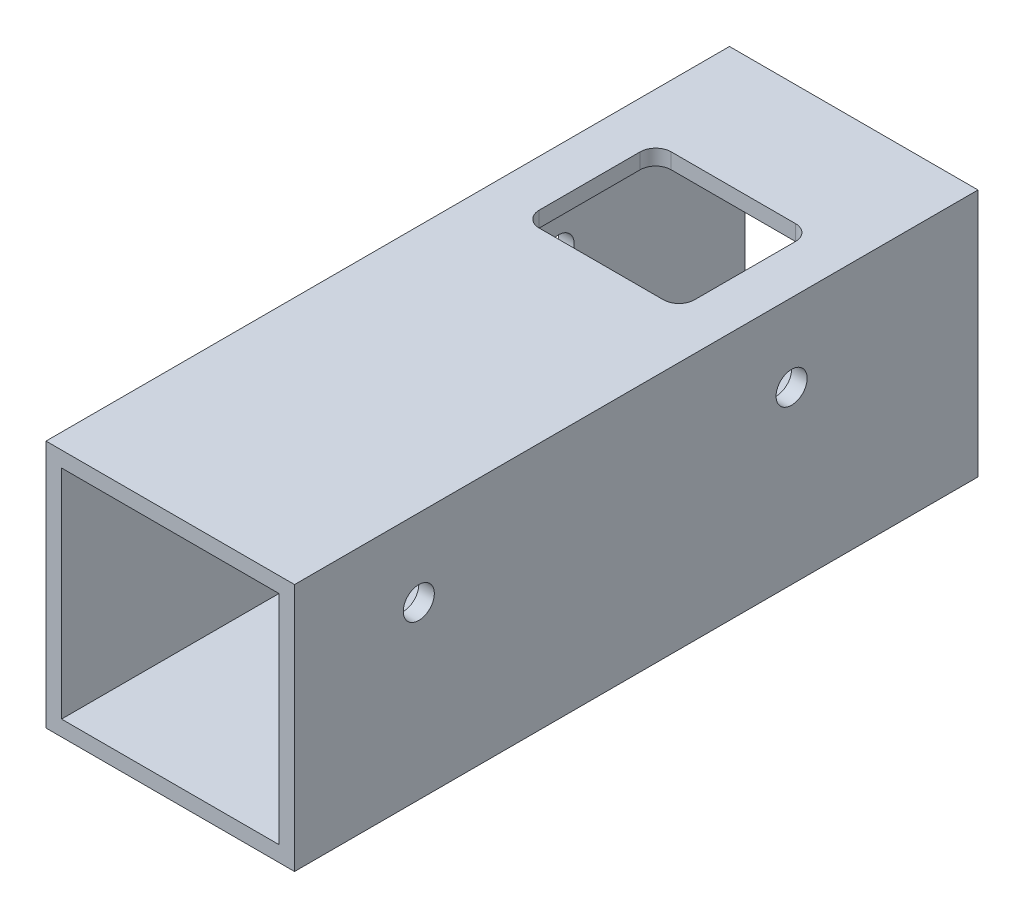
from build123d import *

# Parameters (mm, degrees)
SKETCH1_W               = 50.8
SKETCH1_H               = 50.8
BOSS_EXTRUDE1_DEPTH     = 69.85
SHELL1_T                = -3.175
SKETCH2_W               = 31.75
SKETCH2_H               = 26.9875
CUT_EXTRUDE1_DEPTH      = 79.545162168
FILLET1_R               = 3.175
CUT_EXTRUDE2_DEPTH      = 79.545162168
CUT_EXTRUDE2_DEPTH_BACK = 79.545162168
SKETCH3_R               = 3.175


with BuildPart() as part:
    # Sketch1 → Boss-Extrude1 (new, symmetric)
    with BuildSketch(Plane.XY):
        Rectangle(SKETCH1_W, SKETCH1_H)
    extrude(amount=BOSS_EXTRUDE1_DEPTH, both=True)

    # Shell1
    shell1_openings = [part.faces().sort_by_distance(p)[0] for p in [
        (0, 0, -69.85),
        (0, 0, 69.85),
    ]]
    offset(amount=SHELL1_T, openings=shell1_openings, kind=Kind.INTERSECTION)

    # Sketch2 → Cut-Extrude1 (cut, through all)
    with BuildSketch(Plane(origin=(0, 0, 0), x_dir=(1, 0, 0), z_dir=(0, 1, 0))):
        with Locations((0, 31.75)):
            Rectangle(SKETCH2_W, SKETCH2_H)
    extrude(amount=CUT_EXTRUDE1_DEPTH, mode=Mode.SUBTRACT)

    # Fillet1
    fillet1_edges = [part.edges().sort_by_distance(p)[0] for p in [
        (15.875, 23.8125, -45.24375),
        (-15.875, 23.8125, -45.24375),
        (-15.875, 23.8125, -18.25625),
        (15.875, 23.8125, -18.25625),
    ]]
    fillet(fillet1_edges, radius=FILLET1_R)

    # Sketch3 → Cut-Extrude2 (cut, two sides: drawn at the far end of the back side and taken through both)
    with BuildSketch(Plane(origin=(0, 0, 0), x_dir=(0, 0, -1), z_dir=(1, 0, 0)).offset(-CUT_EXTRUDE2_DEPTH_BACK)):
        with Locations((31.75, 9.525)):
            Circle(SKETCH3_R)
        with Locations((-44.45, 9.525)):
            Circle(SKETCH3_R)
    extrude(amount=CUT_EXTRUDE2_DEPTH + CUT_EXTRUDE2_DEPTH_BACK, mode=Mode.SUBTRACT)


solid = part.part
